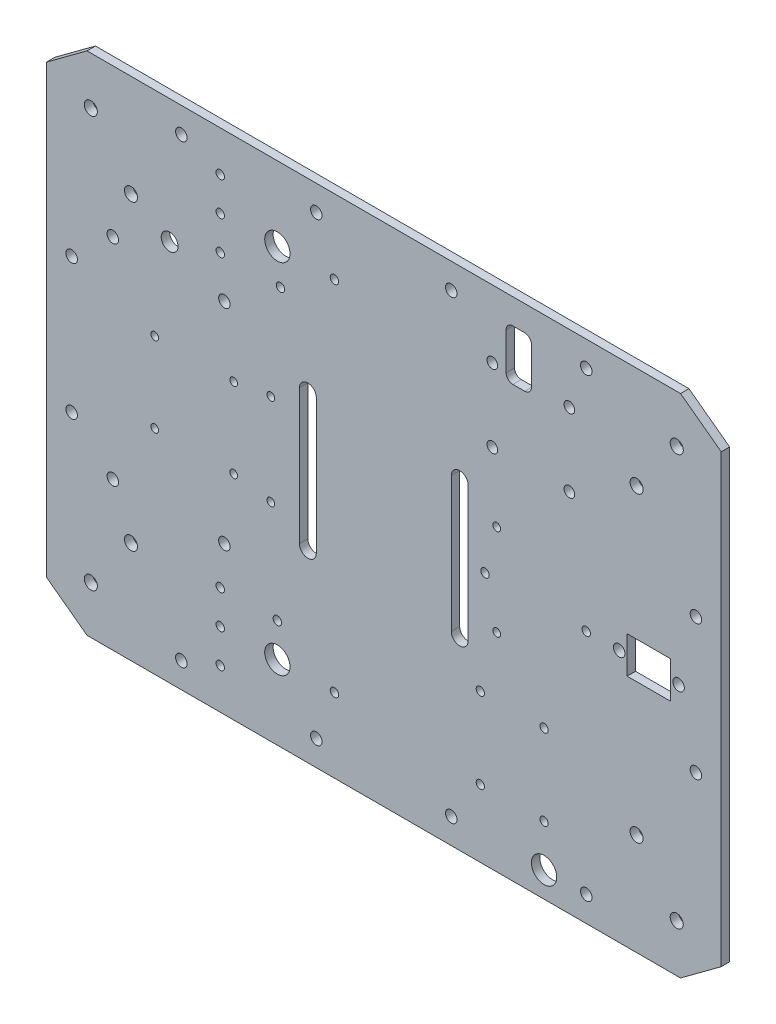
from build123d import *

# Parameters (mm, degrees)
SKETCH1_R                = 2.4638
BOSS_EXTRUDE1_DEPTH      = 3.175
SKETCH2_W                = 16.383
SKETCH2_H                = 13.843
SKETCH2_R                = 2.159
CUT_EXTRUDE1_DEPTH       = 159.781746826
SKETCH5_R                = 3.175
SKETCH5_R_2              = 2.159
SKETCH5_R_3              = 1.4478
CUT_EXTRUDE2_DEPTH       = 159.781746826
SKETCH6_R                = 2.159
CUT_EXTRUDE3_DEPTH       = 159.781746826
SKETCH5_3_R              = 1.45415
CUT_EXTRUDE4_DEPTH       = 159.781746826
SKETCH5_4_R              = 1.5875
SKETCH5_4_R_2            = 4.7625
CUT_EXTRUDE5_DEPTH       = 159.781746826
SKETCH5_5_R              = 1.5875
CUT_EXTRUDE6_DEPTH       = 2.54
SKETCH5_6_R              = 1.5875
CUT_EXTRUDE7_DEPTH       = 159.781746826
CUT_EXTRUDE8_DEPTH       = 7.62
CUT_EXTRUDE8_DEPTH_BACK  = 2.54
SKETCH5_7_W              = 9.525
SKETCH5_7_H              = 19.05
SKETCH5_7_R              = 1.5875
SKETCH5_9_R              = 1.5875
CUT_EXTRUDE9_DEPTH       = 159.781746826
CUT_EXTRUDE17_DEPTH      = 159.781746826
CUT_EXTRUDE17_DEPTH_BACK = 159.781746826
SKETCH5_15_W             = 9.525
SKETCH5_15_H             = 19.05
FILLET1_R                = 2.54
FILLET2_R                = 2.54
FILLET3_R                = 2.54
FILLET4_R                = 2.54
SKETCH9_R                = 1.55
SKETCH9_R_2              = 2
SKETCH9_R_3              = 1.5875
CUT_EXTRUDE18_DEPTH      = 159.781746826


with BuildPart() as part:
    # Sketch1 → Boss-Extrude1 (new body)
    with BuildSketch(Plane.XY):
        Polygon((-111.686526805, -95.25), (-127, -83.918625912), (-127, 83.918625912), (-111.686526805, 95.25), (111.686526805, 95.25), (127, 83.918625912), (127, -83.918625912), (111.686526805, -95.25), align=None)
        with Locations((-95.147512794, 56.885632681)):
            Circle(SKETCH1_R, mode=Mode.SUBTRACT)
        with Locations((-110.256011578, 77.303596941)):
            Circle(SKETCH1_R, mode=Mode.SUBTRACT)
        with Locations((110.256011578, 77.303596941)):
            Circle(SKETCH1_R, mode=Mode.SUBTRACT)
        with Locations((95.147512794, 56.885632681)):
            Circle(SKETCH1_R, mode=Mode.SUBTRACT)
        with Locations((-110.256011578, -77.303596941)):
            Circle(SKETCH1_R, mode=Mode.SUBTRACT)
        with Locations((-95.147512794, -56.885632681)):
            Circle(SKETCH1_R, mode=Mode.SUBTRACT)
        with Locations((110.256011578, -77.303596941)):
            Circle(SKETCH1_R, mode=Mode.SUBTRACT)
        with Locations((95.147512794, -56.885632681)):
            Circle(SKETCH1_R, mode=Mode.SUBTRACT)
    extrude(amount=BOSS_EXTRUDE1_DEPTH)

    # Sketch2 → Cut-Extrude1 (cut, through all)
    with BuildSketch(Plane.XY.offset(3.175)):
        with Locations((99.772576703, 0)):
            Rectangle(SKETCH2_W, SKETCH2_H)
        with Locations((110.948576703, 0)):
            Circle(SKETCH2_R)
        with Locations((88.596576703, 0)):
            Circle(SKETCH2_R)
    extrude(amount=-CUT_EXTRUDE1_DEPTH, mode=Mode.SUBTRACT)

    # Sketch5 → Cut-Extrude2 (cut, through all)
    with BuildSketch(Plane(origin=(0, 0, 0), x_dir=(-1, 0, 0), z_dir=(0, 0, -1))):
        with Locations((80.594630637, 48.58004)):
            Circle(SKETCH5_R)
        with Locations((59.995230637, -39.49954)):
            Circle(SKETCH5_R_2)
        with Locations((101.994130637, -39.49954)):
            Circle(SKETCH5_R_2)
        with Locations((101.994130637, 39.49954)):
            Circle(SKETCH5_R_2)
        with Locations((59.995230637, 39.49954)):
            Circle(SKETCH5_R_2)
        with BuildLine():
            Line((-31.75, 25.4), (-31.75, -25.4))
            ThreePointArc((-31.75, -25.4), (-28.575, -28.575), (-25.4, -25.4))
            Line((-25.4, -25.4), (-25.4, 25.4))
            ThreePointArc((-25.4, 25.4), (-28.575, 28.575), (-31.75, 25.4))
        make_face()
        with Locations((86.197426463, 15.03413)):
            Circle(SKETCH5_R_3)
        with Locations((56.479426463, 15.03413)):
            Circle(SKETCH5_R_3)
        with Locations((56.479426463, -15.03413)):
            Circle(SKETCH5_R_3)
        with Locations((86.197426463, -15.03413)):
            Circle(SKETCH5_R_3)
        with BuildLine():
            ThreePointArc((31.75, 25.4), (28.575, 28.575), (25.4, 25.4))
            Line((25.4, 25.4), (25.4, -25.4))
            ThreePointArc((25.4, -25.4), (28.575, -28.575), (31.75, -25.4))
            Line((31.75, -25.4), (31.75, 25.4))
        make_face()
    extrude(amount=-CUT_EXTRUDE2_DEPTH, mode=Mode.SUBTRACT)

    # Sketch6 → Cut-Extrude3 (cut, through all)
    with BuildSketch(Plane(origin=(0, 0, 0), x_dir=(-1, 0, 0), z_dir=(0, 0, -1))):
        with Locations((-76.2, -85.725)):
            Circle(SKETCH6_R)
        with Locations((-25.4, -85.725)):
            Circle(SKETCH6_R)
        with Locations((25.4, -85.725)):
            Circle(SKETCH6_R)
        with Locations((76.2, -85.725)):
            Circle(SKETCH6_R)
        with Locations((76.2, 85.725)):
            Circle(SKETCH6_R)
        with Locations((25.4, 85.725)):
            Circle(SKETCH6_R)
        with Locations((-25.4, 85.725)):
            Circle(SKETCH6_R)
        with Locations((-76.2, 85.725)):
            Circle(SKETCH6_R)
        with Locations((117.475, -25.4)):
            Circle(SKETCH6_R)
        with Locations((117.475, 25.4)):
            Circle(SKETCH6_R)
        with Locations((-117.475, 25.4)):
            Circle(SKETCH6_R)
        with Locations((-117.475, -25.4)):
            Circle(SKETCH6_R)
    extrude(amount=-CUT_EXTRUDE3_DEPTH, mode=Mode.SUBTRACT)

    # Sketch5<3> → Cut-Extrude4 (cut, through all)
    with BuildSketch(Plane(origin=(0, 0, 0), x_dir=(-1, 0, 0), z_dir=(0, 0, -1))):
        with Locations((-42.5, 17.2)):
            Circle(SKETCH5_3_R)
        with Locations((-42.5, -17.2)):
            Circle(SKETCH5_3_R)
        with Locations((42.5, -17.2)):
            Circle(SKETCH5_3_R)
        with Locations((42.5, 17.2)):
            Circle(SKETCH5_3_R)
    extrude(amount=-CUT_EXTRUDE4_DEPTH, mode=Mode.SUBTRACT)

    # Sketch5<4> → Cut-Extrude5 (cut, through all)
    with BuildSketch(Plane(origin=(0, 0, 0), x_dir=(-1, 0, 0), z_dir=(0, 0, -1))):
        with Locations((61.544630637, -54.61)):
            Circle(SKETCH5_4_R)
        with Locations((61.544630637, -67.31)):
            Circle(SKETCH5_4_R)
        with Locations((-60.325, -85.725)):
            Circle(SKETCH5_4_R_2)
        with Locations((61.544630637, 54.61)):
            Circle(SKETCH5_4_R)
        with Locations((61.544630637, -80.01)):
            Circle(SKETCH5_4_R)
        with Locations((40.055369363, -67.31)):
            Circle(SKETCH5_4_R_2)
        with Locations((61.544630637, 67.31)):
            Circle(SKETCH5_4_R)
        with Locations((61.544630637, 80.01)):
            Circle(SKETCH5_4_R)
        with Locations((40.055369363, 67.31)):
            Circle(SKETCH5_4_R_2)
    extrude(amount=-CUT_EXTRUDE5_DEPTH, mode=Mode.SUBTRACT)

    # Sketch5<5> → Cut-Extrude6 (cut)
    with BuildSketch(Plane(origin=(0, 0, 0), x_dir=(-1, 0, 0), z_dir=(0, 0, -1))):
        with Locations((18.566108088, 67.31)):
            Circle(SKETCH5_5_R)
        with Locations((38.886108088, 54.61)):
            Circle(SKETCH5_5_R)
        with Locations((18.566108088, -67.31)):
            Circle(SKETCH5_5_R)
    extrude(amount=-CUT_EXTRUDE6_DEPTH, mode=Mode.SUBTRACT)

    # Sketch5<6> → Cut-Extrude7 (cut, through all)
    with BuildSketch(Plane(origin=(0, 0, 0), x_dir=(-1, 0, 0), z_dir=(0, 0, -1))):
        with Locations((18.566108088, 67.31)):
            Circle(SKETCH5_6_R)
        with Locations((38.886108088, 54.61)):
            Circle(SKETCH5_6_R)
        with Locations((18.566108088, -67.31)):
            Circle(SKETCH5_6_R)
    extrude(amount=-CUT_EXTRUDE7_DEPTH, mode=Mode.SUBTRACT)

    # Sketch5<7> → Cut-Extrude8 (cut, two sides: drawn at the far end of the back side and taken through both)
    with BuildSketch(Plane(origin=(0, 0, 0), x_dir=(-1, 0, 0), z_dir=(0, 0, -1)).offset(-CUT_EXTRUDE8_DEPTH_BACK)):
        with Locations((-50.8, 76.2)):
            Rectangle(SKETCH5_7_W, SKETCH5_7_H)
        with Locations((40.055369363, -54.61)):
            Circle(SKETCH5_7_R)
    extrude(amount=CUT_EXTRUDE8_DEPTH + CUT_EXTRUDE8_DEPTH_BACK, mode=Mode.SUBTRACT)

    # Sketch5<9> → Cut-Extrude9 (cut, through all)
    with BuildSketch(Plane(origin=(0, 0, 0), x_dir=(-1, 0, 0), z_dir=(0, 0, -1))):
        with Locations((40.055369363, -54.61)):
            Circle(SKETCH5_9_R)
    extrude(amount=-CUT_EXTRUDE9_DEPTH, mode=Mode.SUBTRACT)

    # Sketch5<15> → Cut-Extrude17 (cut, two sides: drawn at the far end of the back side and taken through both)
    with BuildSketch(Plane(origin=(0, 0, 0), x_dir=(-1, 0, 0), z_dir=(0, 0, -1)).offset(-CUT_EXTRUDE17_DEPTH_BACK)):
        with Locations((-50.8, 76.2)):
            Rectangle(SKETCH5_15_W, SKETCH5_15_H)
    extrude(amount=CUT_EXTRUDE17_DEPTH + CUT_EXTRUDE17_DEPTH_BACK, mode=Mode.SUBTRACT)

    # Fillet1
    fillet1_edges = [part.edges().sort_by_distance(p)[0] for p in [
        (55.5625, 85.725, 1.5875),
    ]]
    fillet(fillet1_edges, radius=FILLET1_R)

    # Fillet2
    fillet2_edges = [part.edges().sort_by_distance(p)[0] for p in [
        (46.0375, 85.725, 1.5875),
    ]]
    fillet(fillet2_edges, radius=FILLET2_R)

    # Fillet3
    fillet3_edges = [part.edges().sort_by_distance(p)[0] for p in [
        (46.0375, 66.675, 1.5875),
    ]]
    fillet(fillet3_edges, radius=FILLET3_R)

    # Fillet4
    fillet4_edges = [part.edges().sort_by_distance(p)[0] for p in [
        (55.5625, 66.675, 1.5875),
    ]]
    fillet(fillet4_edges, radius=FILLET4_R)

    # Sketch9 → Cut-Extrude18 (cut, through all)
    with BuildSketch(Plane.XY.offset(3.175)):
        with Locations((36.325, -39.45)):
            Circle(SKETCH9_R)
        with Locations((60.325, -39.45)):
            Circle(SKETCH9_R)
        with Locations((60.325, -69.85)):
            Circle(SKETCH9_R)
        with Locations((36.325, -69.85)):
            Circle(SKETCH9_R)
        with Locations((69.85, 69.85)):
            Circle(SKETCH9_R_2)
        with Locations((40.85, 69.85)):
            Circle(SKETCH9_R_2)
        with Locations((40.85, 42.35)):
            Circle(SKETCH9_R_2)
        with Locations((69.85, 42.35)):
            Circle(SKETCH9_R_2)
        with Locations((76.2, 0)):
            Circle(SKETCH9_R_3)
        with Locations((38.1, 0)):
            Circle(SKETCH9_R_3)
    extrude(amount=-CUT_EXTRUDE18_DEPTH, mode=Mode.SUBTRACT)


solid = part.part
